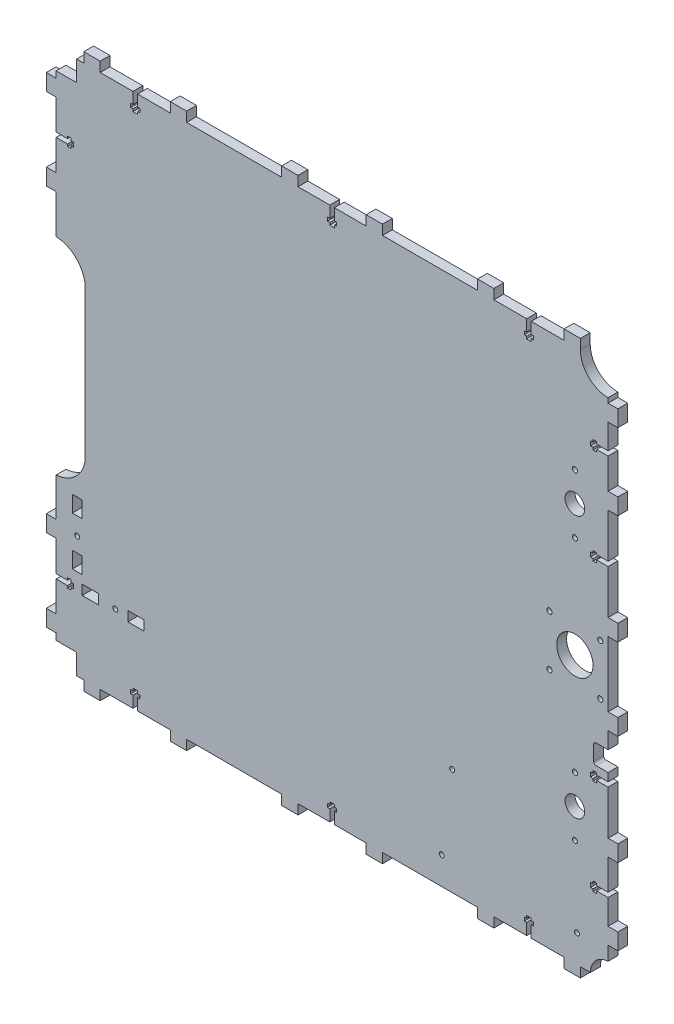
from build123d import *

# Parameters (mm, degrees)
SKETCH_1_R      = 6
SKETCH_1_R_2    = 1.6
SKETCH_1_R_3    = 1.55
SKETCH_1_R_4    = 11.1
SKETCH_1_R_5    = 1.5
SKETCH_1_W      = 9.9
SKETCH_1_H      = 6
SKETCH_1_W_2    = 6
SKETCH_1_H_2    = 9.9
EXTRUDE_1_DEPTH = 6


with BuildPart() as part:
    # Эскиз1 → Бобышка-Вытянуть1 (new body)
    with BuildSketch(Plane.XY):
        with BuildLine():
            Line((168.199310706, -52.298122462), (168.199310706, -57.218125343))
            Line((168.199310706, -57.218125343), (161.199309499, -57.218125343))
            Line((161.199309499, -57.218125343), (161.199309499, -55.815811247))
            Line((161.199309499, -55.815811247), (158.998486916, -55.815811247))
            Line((158.998486916, -55.815811247), (158.999308988, -57.215692211))
            Line((158.999308988, -57.215692211), (157.499309247, -57.216573077))
            Line((157.499309247, -57.216573077), (157.500952992, -60.015655883))
            Line((157.500952992, -60.015655883), (159.000952734, -60.014775017))
            Line((159.000952734, -60.014775017), (159.001775414, -61.415692272))
            Line((159.001775414, -61.415692272), (161.202727499, -61.415745636))
            Line((161.202727499, -61.415745636), (161.202286063, -60.018125343))
            Line((161.202286063, -60.018125343), (168.199310706, -60.018125343))
            Line((168.199310706, -60.018125343), (168.199310706, -87.018125343))
            Line((168.199310706, -87.018125343), (174.199310706, -87.018125343))
            Line((174.199310706, -87.018125343), (174.199310706, -97.018125338))
            Line((174.199310706, -97.018125338), (168.199310706, -97.018125338))
            Line((168.199310706, -97.018125338), (168.199310706, -115.618125338))
            Line((168.199310706, -115.618125338), (161.199752595, -115.618125338))
            Line((161.199752595, -115.618125338), (161.199752595, -114.216834131))
            Line((161.199752595, -114.216834131), (158.998486916, -114.216834131))
            Line((158.998486916, -114.216834131), (158.999308988, -115.616715096))
            Line((158.999308988, -115.616715096), (157.499309247, -115.617595962))
            Line((157.499309247, -115.617595962), (157.500952992, -118.416678768))
            Line((157.500952992, -118.416678768), (159.000952734, -118.415797902))
            Line((159.000952734, -118.415797902), (159.001775414, -119.816715157))
            Line((159.001775414, -119.816715157), (161.202113772, -119.816768506))
            Line((161.202113772, -119.816768506), (161.201876481, -118.418125338))
            Line((161.201876481, -118.418125338), (168.199310706, -118.418125338))
            Line((168.199310706, -118.418125338), (168.199310706, -133.598125338))
            Line((168.199310706, -133.598125338), (174.199310706, -133.598125338))
            Line((174.199310706, -133.598125338), (174.199310706, -143.598125338))
            Line((174.199310706, -143.598125338), (168.199310706, -143.598125338))
            Line((168.199310706, -143.598125338), (168.199310706, -152.12715677))
            ThreePointArc((168.199310706, -152.12715677), (160.572403694, -155.612835394), (157.456488656, -163.398125338))
            Line((157.456488656, -163.398125338), (151.289310706, -163.398125338))
            Line((151.289310706, -163.398125338), (151.289310706, -169.398125338))
            Line((151.289310706, -169.398125338), (141.289310706, -169.398125338))
            Line((141.289310706, -169.398125338), (141.289310706, -163.398125338))
            Line((141.289310706, -163.398125338), (121.289310706, -163.398125338))
            Line((121.289310706, -163.398125338), (121.289310706, -156.4006243))
            Line((121.289310706, -156.4006243), (122.688120776, -156.400828255))
            Line((122.688120776, -156.400828255), (122.68806743, -154.200590047))
            Line((122.68806743, -154.200590047), (121.287150175, -154.199767366))
            Line((121.287150175, -154.199767366), (121.288031041, -152.699767026))
            Line((121.288031041, -152.699767026), (118.489968512, -152.69812388))
            Line((118.489968512, -152.69812388), (118.489087646, -154.198123621))
            Line((118.489087646, -154.198123621), (117.089206681, -154.197301549))
            Line((117.089206681, -154.197301549), (117.089206681, -156.398124131))
            Line((117.089206681, -156.398124131), (118.489310706, -156.398124131))
            Line((118.489310706, -156.398124131), (118.489310706, -163.398125338))
            Line((118.489310706, -163.398125338), (98.489310706, -163.398125338))
            Line((98.489310706, -163.398125338), (98.489310706, -169.398125338))
            Line((98.489310706, -169.398125338), (88.489310706, -169.398125338))
            Line((88.489310706, -169.398125338), (88.489310706, -163.398125338))
            Line((88.489310706, -163.398125338), (30.489310706, -163.398125338))
            Line((30.489310706, -163.398125338), (30.489310706, -169.398125338))
            Line((30.489310706, -169.398125338), (20.489310706, -169.398125338))
            Line((20.489310706, -169.398125338), (20.489310706, -163.398125338))
            Line((20.489310706, -163.398125338), (1.099310706, -163.398125338))
            Line((1.099310706, -163.398125338), (1.099310706, -156.4006243))
            Line((1.099310706, -156.4006243), (2.498120776, -156.400828255))
            Line((2.498120776, -156.400828255), (2.49806743, -154.200590047))
            Line((2.49806743, -154.200590047), (1.097150175, -154.199767366))
            Line((1.097150175, -154.199767366), (1.098031041, -152.699767026))
            Line((1.098031041, -152.699767026), (-1.700031488, -152.69812388))
            Line((-1.700031488, -152.69812388), (-1.700912354, -154.198123621))
            Line((-1.700912354, -154.198123621), (-3.100793319, -154.197301549))
            Line((-3.100793319, -154.197301549), (-3.100793319, -156.398124131))
            Line((-3.100793319, -156.398124131), (-1.700689294, -156.398124131))
            Line((-1.700689294, -156.398124131), (-1.700689294, -163.398125338))
            Line((-1.700689294, -163.398125338), (-21.090689294, -163.398125338))
            Line((-21.090689294, -163.398125338), (-21.090689294, -169.398125338))
            Line((-21.090689294, -169.398125338), (-31.090689294, -169.398125338))
            Line((-31.090689294, -169.398125338), (-31.090689294, -163.398125338))
            Line((-31.090689294, -163.398125338), (-89.090689294, -163.398125338))
            Line((-89.090689294, -163.398125338), (-89.090689294, -169.398125338))
            Line((-89.090689294, -169.398125338), (-99.090689294, -169.398125338))
            Line((-99.090689294, -169.398125338), (-99.090689294, -163.398125338))
            Line((-99.090689294, -163.398125338), (-119.090689294, -163.398125338))
            Line((-119.090689294, -163.398125338), (-119.090689294, -156.4006243))
            Line((-119.090689294, -156.4006243), (-117.691879224, -156.400828255))
            Line((-117.691879224, -156.400828255), (-117.69193257, -154.200590047))
            Line((-117.69193257, -154.200590047), (-119.092849825, -154.199767366))
            Line((-119.092849825, -154.199767366), (-119.091968959, -152.699767026))
            Line((-119.091968959, -152.699767026), (-121.890031488, -152.69812388))
            Line((-121.890031488, -152.69812388), (-121.890912354, -154.198123621))
            Line((-121.890912354, -154.198123621), (-123.290793319, -154.197301549))
            Line((-123.290793319, -154.197301549), (-123.290793319, -156.398124131))
            Line((-123.290793319, -156.398124131), (-121.890689294, -156.398124131))
            Line((-121.890689294, -156.398124131), (-121.890689294, -163.398125338))
            Line((-121.890689294, -163.398125338), (-141.890689294, -163.398125338))
            Line((-141.890689294, -163.398125338), (-141.890689294, -169.398125338))
            Line((-141.890689294, -169.398125338), (-151.890689294, -169.398125338))
            Line((-151.890689294, -169.398125338), (-151.890689294, -163.398125338))
            Line((-151.890689294, -163.398125338), (-156.195092631, -163.398125338))
            Line((-156.195092631, -163.398125338), (-156.195092631, -151.950559202))
            ThreePointArc((-156.195092631, -151.950559202), (-156.443252823, -151.291213387), (-157.064566439, -150.959114341))
            Line((-157.064566439, -150.959114341), (-157.195092631, -150.950559202))
            Line((-157.195092631, -150.950559202), (-168.800689294, -150.950559202))
            Line((-168.800689294, -150.950559202), (-168.800689294, -146.938125338))
            Line((-168.800689294, -146.938125338), (-174.800689294, -146.938125338))
            Line((-174.800689294, -146.938125338), (-174.800689294, -136.938125338))
            Line((-174.800689294, -136.938125338), (-168.800689294, -136.938125338))
            Line((-168.800689294, -136.938125338), (-168.800689294, -118.438125338))
            Line((-168.800689294, -118.438125338), (-161.800688087, -118.438125338))
            Line((-161.800688087, -118.438125338), (-161.800688087, -119.838229363))
            Line((-161.800688087, -119.838229363), (-159.599865505, -119.838229363))
            Line((-159.599865505, -119.838229363), (-159.600686983, -118.439360374))
            Line((-159.600686983, -118.439360374), (-158.100196827, -118.43847922))
            Line((-158.100196827, -118.43847922), (-158.095498836, -115.637580558))
            Line((-158.095498836, -115.637580558), (-159.602331088, -115.638721675))
            Line((-159.602331088, -115.638721675), (-159.603391996, -114.237804581))
            Line((-159.603391996, -114.237804581), (-161.803392384, -114.238125353))
            Line((-161.803392384, -114.238125353), (-161.803188256, -115.638125338))
            Line((-161.803188256, -115.638125338), (-168.800689294, -115.638125338))
            Line((-168.800689294, -115.638125338), (-168.800689294, -96.918125338))
            Line((-168.800689294, -96.918125338), (-174.800689294, -96.918125338))
            Line((-174.800689294, -96.918125338), (-174.800689294, -86.918125338))
            Line((-174.800689294, -86.918125338), (-168.800689294, -86.918125338))
            Line((-168.800689294, -86.918125338), (-168.800689294, -63.480258903))
            ThreePointArc((-168.800689294, -63.480258903), (-157.388702527, -58.725695754), (-151.244839154, -47.997589884))
            Line((-151.244839154, -47.997589884), (-151.272354325, 47.500944109))
            ThreePointArc((-151.272354325, 47.500944109), (-157.419219349, 58.082787741), (-168.800689294, 62.579620646))
            Line((-168.800689294, 62.579620646), (-168.800689294, 86.321874662))
            Line((-168.800689294, 86.321874662), (-174.800689294, 86.321874662))
            Line((-174.800689294, 86.321874662), (-174.800689294, 96.321874662))
            Line((-174.800689294, 96.321874662), (-168.800689294, 96.321874662))
            Line((-168.800689294, 96.321874662), (-168.800689294, 115.041874662))
            Line((-168.800689294, 115.041874662), (-161.800688087, 115.041874662))
            Line((-161.800688087, 115.041874662), (-161.800688087, 113.641770637))
            Line((-161.800688087, 113.641770637), (-159.599865505, 113.641770637))
            Line((-159.599865505, 113.641770637), (-159.600687577, 115.041651602))
            Line((-159.600687577, 115.041651602), (-158.100210407, 115.042532748))
            Line((-158.100210407, 115.042532748), (-158.102330745, 117.842414269))
            Line((-158.102330745, 117.842414269), (-159.602331088, 117.841278325))
            Line((-159.602331088, 117.841278325), (-159.603391996, 119.242195419))
            Line((-159.603391996, 119.242195419), (-161.803392384, 119.241874647))
            Line((-161.803392384, 119.241874647), (-161.803188256, 117.841874662))
            Line((-161.803188256, 117.841874662), (-168.800689294, 117.841874662))
            Line((-168.800689294, 117.841874662), (-168.800689294, 136.341874662))
            Line((-168.800689294, 136.341874662), (-174.800689294, 136.341874662))
            Line((-174.800689294, 136.341874662), (-174.800689294, 146.341874662))
            Line((-174.800689294, 146.341874662), (-168.800689294, 146.341874662))
            Line((-168.800689294, 146.341874662), (-168.800689294, 150.22196022))
            Line((-168.800689294, 150.22196022), (-157.195092631, 150.22196022))
            ThreePointArc((-157.195092631, 150.22196022), (-156.48798585, 150.514853439), (-156.195092631, 151.22196022))
            Line((-156.195092631, 151.22196022), (-156.195092631, 162.801874662))
            Line((-156.195092631, 162.801874662), (-151.890689294, 162.801874662))
            Line((-151.890689294, 162.801874662), (-151.890689294, 168.801874662))
            Line((-151.890689294, 168.801874662), (-141.890689294, 168.801874662))
            Line((-141.890689294, 168.801874662), (-141.890689294, 162.801874662))
            Line((-141.890689294, 162.801874662), (-121.890689294, 162.801874662))
            Line((-121.890689294, 162.801874662), (-121.890689294, 155.801873455))
            Line((-121.890689294, 155.801873455), (-123.290793319, 155.801873455))
            Line((-123.290793319, 155.801873455), (-123.290793319, 153.601050872))
            Line((-123.290793319, 153.601050872), (-121.890912354, 153.601872944))
            Line((-121.890912354, 153.601872944), (-121.890031488, 152.101873203))
            Line((-121.890031488, 152.101873203), (-119.091968959, 152.103516349))
            Line((-119.091968959, 152.103516349), (-119.092849825, 153.60351669))
            Line((-119.092849825, 153.60351669), (-117.69193257, 153.60433937))
            Line((-117.69193257, 153.60433937), (-117.691879224, 155.804577578))
            Line((-117.691879224, 155.804577578), (-119.090689294, 155.804373623))
            Line((-119.090689294, 155.804373623), (-119.090689294, 162.801874662))
            Line((-119.090689294, 162.801874662), (-99.090689294, 162.801874662))
            Line((-99.090689294, 162.801874662), (-99.090689294, 168.801874662))
            Line((-99.090689294, 168.801874662), (-89.090689294, 168.801874662))
            Line((-89.090689294, 168.801874662), (-89.090689294, 162.801874662))
            Line((-89.090689294, 162.801874662), (-31.090689294, 162.801874662))
            Line((-31.090689294, 162.801874662), (-31.090689294, 168.801874662))
            Line((-31.090689294, 168.801874662), (-21.090689294, 168.801874662))
            Line((-21.090689294, 168.801874662), (-21.090689294, 162.801874662))
            Line((-21.090689294, 162.801874662), (-1.700689294, 162.801874662))
            Line((-1.700689294, 162.801874662), (-1.700689294, 155.801873455))
            Line((-1.700689294, 155.801873455), (-3.100793319, 155.801873455))
            Line((-3.100793319, 155.801873455), (-3.100793319, 153.601050872))
            Line((-3.100793319, 153.601050872), (-1.700912354, 153.601872944))
            Line((-1.700912354, 153.601872944), (-1.700031488, 152.101873203))
            Line((-1.700031488, 152.101873203), (1.098031041, 152.103516349))
            Line((1.098031041, 152.103516349), (1.097150175, 153.60351669))
            Line((1.097150175, 153.60351669), (2.49806743, 153.60433937))
            Line((2.49806743, 153.60433937), (2.498120776, 155.804577578))
            Line((2.498120776, 155.804577578), (1.099310706, 155.804373623))
            Line((1.099310706, 155.804373623), (1.099310706, 162.801874662))
            Line((1.099310706, 162.801874662), (20.489310706, 162.801874662))
            Line((20.489310706, 162.801874662), (20.489310706, 168.801874662))
            Line((20.489310706, 168.801874662), (30.489310706, 168.801874662))
            Line((30.489310706, 168.801874662), (30.489310706, 162.801874662))
            Line((30.489310706, 162.801874662), (88.489310706, 162.801874662))
            Line((88.489310706, 162.801874662), (88.489310706, 168.801874662))
            Line((88.489310706, 168.801874662), (98.489310706, 168.801874662))
            Line((98.489310706, 168.801874662), (98.489310706, 162.801874662))
            Line((98.489310706, 162.801874662), (118.489310706, 162.801874662))
            Line((118.489310706, 162.801874662), (118.489310706, 155.801873455))
            Line((118.489310706, 155.801873455), (117.089206681, 155.801873455))
            Line((117.089206681, 155.801873455), (117.089206681, 153.601050872))
            Line((117.089206681, 153.601050872), (118.489087646, 153.601872944))
            Line((118.489087646, 153.601872944), (118.489968512, 152.101873203))
            Line((118.489968512, 152.101873203), (121.288031041, 152.103516349))
            Line((121.288031041, 152.103516349), (121.287150175, 153.60351669))
            Line((121.287150175, 153.60351669), (122.68806743, 153.60433937))
            Line((122.68806743, 153.60433937), (122.688120776, 155.804577578))
            Line((122.688120776, 155.804577578), (121.289310706, 155.804373623))
            Line((121.289310706, 155.804373623), (121.289310706, 162.801874662))
            Line((121.289310706, 162.801874662), (141.289310706, 162.801874662))
            Line((141.289310706, 162.801874662), (141.289310706, 168.801874662))
            Line((141.289310706, 168.801874662), (151.289310706, 168.801874662))
            Line((151.289310706, 168.801874662), (151.289310706, 162.801874662))
            ThreePointArc((151.289310706, 162.801874662), (156.242135036, 150.844698992), (168.199310706, 145.891874662))
            Line((168.199310706, 145.891874662), (168.199310706, 143.001874662))
            Line((168.199310706, 143.001874662), (174.199310706, 143.001874662))
            Line((174.199310706, 143.001874662), (174.199310706, 133.001874662))
            Line((174.199310706, 133.001874662), (168.199310706, 133.001874662))
            Line((168.199310706, 133.001874662), (168.199310706, 117.821874662))
            Line((168.199310706, 117.821874662), (161.198884876, 117.821874662))
            Line((161.198884876, 117.821874662), (161.198672593, 119.221937544))
            Line((161.198672593, 119.221937544), (158.997850029, 119.221603845))
            Line((158.997850029, 119.221603845), (158.998884357, 117.821723022))
            Line((158.998884357, 117.821723022), (157.498884767, 117.820614719))
            Line((157.498884767, 117.820614719), (157.500952921, 115.021532194))
            Line((157.500952921, 115.021532194), (159.000952512, 115.022640497))
            Line((159.000952512, 115.022640497), (159.001987605, 113.621723383))
            Line((159.001987605, 113.621723383), (161.202013777, 113.622003619))
            Line((161.202013777, 113.622003619), (161.201809668, 115.021874662))
            Line((161.201809668, 115.021874662), (168.199310706, 115.021874662))
            Line((168.199310706, 115.021874662), (168.199310706, 96.421874662))
            Line((168.199310706, 96.421874662), (174.199310706, 96.421874662))
            Line((174.199310706, 96.421874662), (174.199310706, 86.421874662))
            Line((174.199310706, 86.421874662), (168.199310706, 86.421874662))
            Line((168.199310706, 86.421874662), (168.199310706, 59.421874662))
            Line((168.199310706, 59.421874662), (161.199309232, 59.421874662))
            Line((161.199309232, 59.421874662), (161.199309232, 60.476838077))
            Line((161.199309232, 60.476838077), (158.998486738, 60.476838077))
            Line((158.998486738, 60.476838077), (158.99930881, 59.076957113))
            Line((158.99930881, 59.076957113), (157.499309069, 59.076076247))
            Line((157.499309069, 59.076076247), (157.500952814, 56.276993441))
            Line((157.500952814, 56.276993441), (159.000952556, 56.277874307))
            Line((159.000952556, 56.277874307), (159.001775236, 54.876957052))
            Line((159.001775236, 54.876957052), (161.202064095, 54.876903704))
            Line((161.202064095, 54.876903704), (161.201809668, 56.621874662))
            Line((161.201809668, 56.621874662), (168.199310706, 56.621874662))
            Line((168.199310706, 56.621874662), (168.199310706, 29.621874662))
            Line((168.199310706, 29.621874662), (174.199310706, 29.621874662))
            Line((174.199310706, 29.621874662), (174.199310706, 19.621874662))
            Line((174.199310706, 19.621874662), (168.199310706, 19.621874662))
            Line((168.199310706, 19.621874662), (168.199310706, -20.218125343))
            Line((168.199310706, -20.218125343), (174.199310706, -20.218125343))
            Line((174.199310706, -20.218125343), (174.199310706, -30.218125343))
            Line((174.199310706, -30.218125343), (168.199310706, -30.218125343))
            Line((168.199310706, -30.218125343), (168.199310706, -40.298068824))
            Line((168.199310706, -40.298068824), (160.899314476, -40.305488615))
            ThreePointArc((160.899314476, -40.305488615), (159.839101402, -40.745906282), (159.400839866, -41.807012455))
            Line((159.400839866, -41.807012455), (159.409987554, -50.807007806))
            ThreePointArc((159.409987554, -50.807007806), (159.866776617, -51.884084101), (160.958185364, -52.305482417))
            Line((160.958185364, -52.305482417), (168.199310706, -52.298122462))
        make_face()
        with Locations((147.949520288, -80.298125338)):
            Circle(SKETCH_1_R, mode=Mode.SUBTRACT)
        with Locations((132.449520287, 15.201874662)):
            Circle(SKETCH_1_R_2, mode=Mode.SUBTRACT)
        with Locations((147.949520287, 61.701874662)):
            Circle(SKETCH_1_R_3, mode=Mode.SUBTRACT)
        with Locations((163.449520287, 15.201874662)):
            Circle(SKETCH_1_R_2, mode=Mode.SUBTRACT)
        with Locations((147.949520288, -62.298125338)):
            Circle(SKETCH_1_R_3, mode=Mode.SUBTRACT)
        with Locations((163.449520287, -15.798125338)):
            Circle(SKETCH_1_R_2, mode=Mode.SUBTRACT)
        with Locations((132.449520287, -15.798125338)):
            Circle(SKETCH_1_R_2, mode=Mode.SUBTRACT)
        with Locations((147.949520287, -0.298125338)):
            Circle(SKETCH_1_R_4, mode=Mode.SUBTRACT)
        with Locations((147.949520287, 97.701874662)):
            Circle(SKETCH_1_R_2, mode=Mode.SUBTRACT)
        with Locations((147.949520287, 79.701874662)):
            Circle(SKETCH_1_R, mode=Mode.SUBTRACT)
        with Locations((-132.646005991, -116.230657757)):
            Circle(SKETCH_1_R_5, mode=Mode.SUBTRACT)
        with Locations((-155.896005991, -89.303657757)):
            Circle(SKETCH_1_R_5, mode=Mode.SUBTRACT)
        with Locations((73.019520288, -98.298125338)):
            Circle(SKETCH_1_R_5, mode=Mode.SUBTRACT)
        with Locations((66.669520288, -146.558125338)):
            Circle(SKETCH_1_R_5, mode=Mode.SUBTRACT)
        with Locations((149.249520288, -146.558125338)):
            Circle(SKETCH_1_R_5, mode=Mode.SUBTRACT)
        with Locations((147.949520288, -98.298125338)):
            Circle(SKETCH_1_R_5, mode=Mode.SUBTRACT)
        with Locations((-120.044005991, -116.230657757)):
            Rectangle(SKETCH_1_W, SKETCH_1_H, mode=Mode.SUBTRACT)
        with Locations((-147.946005991, -116.230657757)):
            Rectangle(SKETCH_1_W, SKETCH_1_H, mode=Mode.SUBTRACT)
        with Locations((-155.896005991, -73.691657757)):
            Rectangle(SKETCH_1_W_2, SKETCH_1_H_2, mode=Mode.SUBTRACT)
        with Locations((-155.896005991, -103.280657757)):
            Rectangle(SKETCH_1_W_2, SKETCH_1_H_2, mode=Mode.SUBTRACT)
    extrude(amount=EXTRUDE_1_DEPTH)


solid = part.part
